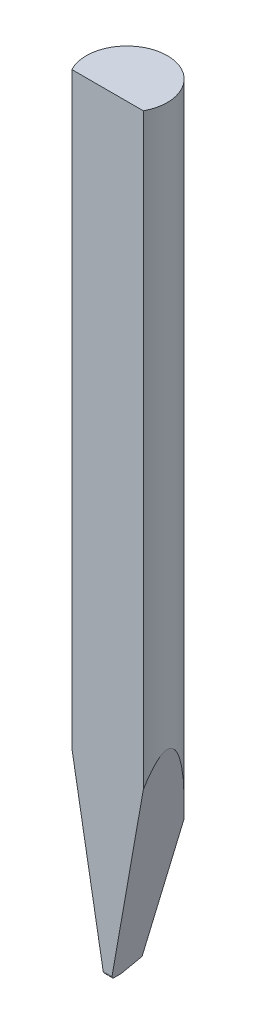
from build123d import *

# Parameters (mm, degrees)
SKETCH_TL_CUTTING_R        = 0.7925
TL_CUTTING_DEPTH           = 15
SKETCH_TDF_GRINDING_W      = 1.605
SKETCH_TDF_GRINDING_H      = 1.605
TDF_GRINDING_DEPTH         = 16.041812141
ISA_GRINDING_DEPTH         = 0.8025
ISA_GRINDING_DEPTH_BACK    = 0.8025
BA_RA_GRINDING_DEPTH       = 0.8025
BA_RA_GRINDING_DEPTH_BACK  = 0.8025
FRO_ERODING_DEPTH          = 0.8025
FRO_ERODING_DEPTH_BACK     = 0.8025
CAVITY_ERODING_START       = -0.0475
CAVITY_ERODING_DEPTH       = 0.095
SKETCH_HOLE_CAVITY_ENTRY_R = 0.0445
SKETCH_END_CONST_SECTION_R = 0.0445
HOLE_START_FUNNEL_R        = 0.0445
SKETCH_END_FUNNEL_R        = 1.080033906
CUT_EXTRUDE1_REACH         = 17.066
FILLET1_R                  = 0.038


# Read off the part's stored shape, not the designer's step: cavity_eroding
with BuildPart() as part:
    # sketch_TL_cutting → TL_cutting (new body)
    with BuildSketch(Plane(origin=(0, 0, 0), x_dir=(1, 0, 0), z_dir=(0, 1, 0))):
        with Locations(Location((0, 0, 0), (0, 0, 270))):
            Circle(SKETCH_TL_CUTTING_R)
    extrude(amount=TL_CUTTING_DEPTH)

    # sketch_TDF_grinding → TDF_grinding (cut, through all)
    with BuildSketch(Plane(origin=(0, 0, 0), x_dir=(1, 0, 0), z_dir=(0, 1, 0))):
        with Locations((0, -1.178)):
            Rectangle(SKETCH_TDF_GRINDING_W, SKETCH_TDF_GRINDING_H)
    extrude(amount=TDF_GRINDING_DEPTH, mode=Mode.SUBTRACT)

    # sketch_ISA_grinding → ISA_grinding (cut, two sides: drawn at the far end of the back side and taken through both)
    with BuildSketch(Plane.XY.offset(-ISA_GRINDING_DEPTH_BACK)):
        Polygon((-0.0775, 0), (-0.8025, 4.111679319), (-0.8025, -0.01), (0.8025, -0.01), (0.8025, 4.111679319), (0.0775, 0), align=None)
    extrude(amount=ISA_GRINDING_DEPTH + ISA_GRINDING_DEPTH_BACK, mode=Mode.SUBTRACT)

    # sketch_BA_RA_grinding → BA_RA_grinding (cut, two sides: drawn at the far end of the back side and taken through both)
    with BuildSketch(Plane(origin=(0, 0, 0), x_dir=(0, 0, -1), z_dir=(1, 0, 0)).offset(-BA_RA_GRINDING_DEPTH_BACK)):
        Polygon((-0.1875, 0), (-0.3755, 0), (-0.3755, -0.01), (4.01816798, -0.01), (4.01816798, 15.01), (2.83016798, 15.01), (0.201897748, 0.104338812), align=None)
    extrude(amount=BA_RA_GRINDING_DEPTH + BA_RA_GRINDING_DEPTH_BACK, mode=Mode.SUBTRACT)

    # sketch_FRO_eroding → FRO_eroding (cut, two sides: drawn at the far end of the back side and taken through both)
    with BuildSketch(Plane(origin=(0, 0, 0), x_dir=(0, 0, -1), z_dir=(1, 0, 0)).offset(-FRO_ERODING_DEPTH_BACK)):
        with BuildLine():
            Line((-0.3755, 0.051), (-0.3855, 0.051))
            Line((-0.3855, 0.051), (-0.3855, -0.01))
            Line((-0.3855, -0.01), (-0.3245, -0.01))
            Line((-0.3245, -0.01), (-0.3245, 0))
            ThreePointArc((-0.3245, 0), (-0.360562446, 0.014937554), (-0.3755, 0.051))
        make_face()
    extrude(amount=FRO_ERODING_DEPTH + FRO_ERODING_DEPTH_BACK, mode=Mode.SUBTRACT)

    # cavity_eroding outline → cavity_eroding (cut)
    with BuildSketch(Plane.YZ.offset(CAVITY_ERODING_START)):
        Polygon((0, 0.1875), (0.055117149, -0.0182), (0.2083, -0.0182), (0.2083, 0.115237939), (0, 0.2355), align=None)
    extrude(amount=CAVITY_ERODING_DEPTH, mode=Mode.SUBTRACT)

    # sketch_hole_cavity_entry → hole_const_section section 0
    with BuildSketch(Plane(origin=(0, 0.162691609, 0.027408387), x_dir=(-1, 0, 0), z_dir=(0, -0.7071067811865479, 0.7071067811865472))):
        Circle(SKETCH_HOLE_CAVITY_ENTRY_R)
    # sketch_end_const_section → hole_const_section section 1
    with BuildSketch(Plane(origin=(0, 0.365639833, -0.175539837), x_dir=(-1, 0, 0), z_dir=(0, -0.7071067811865479, 0.7071067811865472))):
        Circle(SKETCH_END_CONST_SECTION_R)
    loft(mode=Mode.SUBTRACT)

    # hole_start_funnel → hole_funnel section 0
    with BuildSketch(Plane(origin=(0, 0.365639833, -0.175539837), x_dir=(-1, 0, 0), z_dir=(0, -0.7071067811865479, 0.7071067811865472))):
        Circle(HOLE_START_FUNNEL_R)
    # sketch_end_funnel → hole_funnel section 1
    with BuildSketch(Plane(origin=(0, 2.133406786, -1.94330679), x_dir=(-1, 0, 0), z_dir=(0, -0.7071067811865479, 0.7071067811865472))):
        Circle(SKETCH_END_FUNNEL_R)
    loft(mode=Mode.SUBTRACT)

    # Sketch1 → Cut-Extrude1 (cut, up to next)
    with BuildSketch(Plane.XY.offset(0.3755), mode=Mode.PRIVATE) as cut_extrude1_sk1:
        with BuildLine():
            Line((-0.030697365, -0.011145784), (-0.014385299, 0.023835554))
            ThreePointArc((-0.014385299, 0.023835554), (0, 0.033), (0.014385299, 0.023835554))
            Line((0.014385299, 0.023835554), (0.030697365, -0.011145784))
            Line((0.030697365, -0.011145784), (-0.030697365, -0.011145784))
        make_face()
    cut_extrude1_tool1 = extrude(cut_extrude1_sk1.sketch, amount=-CUT_EXTRUDE1_REACH, mode=Mode.PRIVATE) & part.part
    add(cut_extrude1_tool1.solids().sort_by_distance((0, 0.006741, 0.3755))[0], mode=Mode.SUBTRACT)

    # Fillet1
    fillet1_edges = [part.edges().sort_by_distance(p)[0] for p in [
        (0.0365, 0, 0.2355),
        (-0.0365, 0, 0.2355),
    ]]
    fillet(fillet1_edges, radius=FILLET1_R)


solid = part.part
